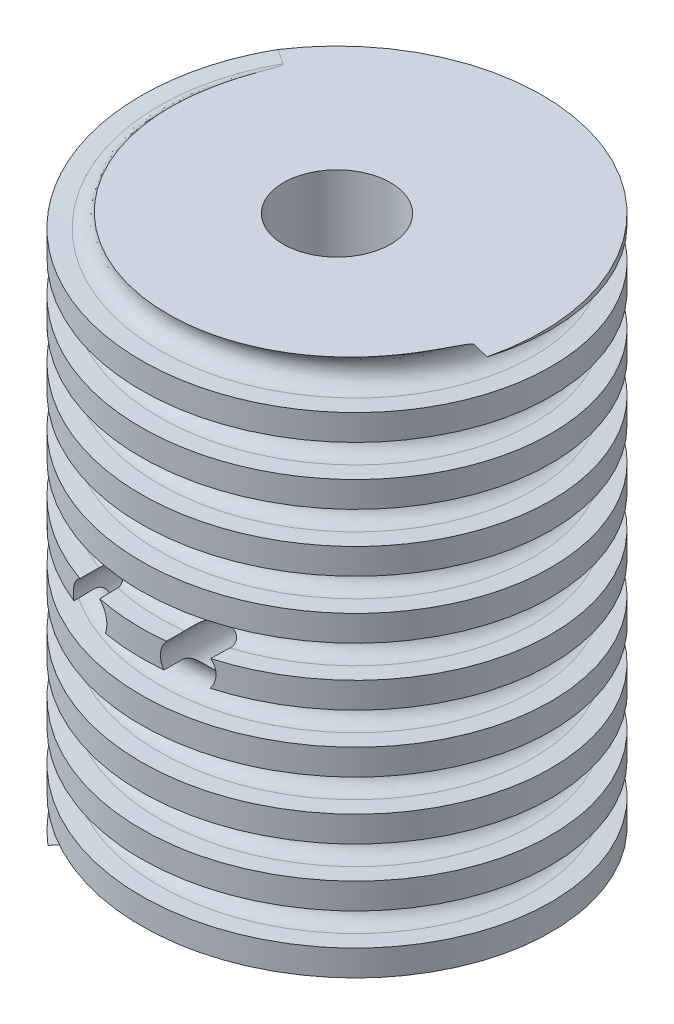
from build123d import *

# Parameters (mm, degrees)
SKETCH1_R           = 11.5
SKETCH1_R_2         = 1.5
BOSS_EXTRUDE1_DEPTH = 30
CUT_SWEEP1_PITCH    = 3.25
SKETCH7_W           = 9.56
SKETCH7_H           = 3.8
CUT_EXTRUDE1_DEPTH  = 6
SKETCH9_R           = 3
CUT_EXTRUDE5_DEPTH  = 25
CUT_EXTRUDE6_REACH  = 38.573
SKETCH8_R           = 1.25


with BuildPart() as part:
    # Sketch1 → Boss-Extrude1 (new body)
    with BuildSketch(Plane(origin=(0, 0, 0), x_dir=(1, 0, 0), z_dir=(0, 1, 0))):
        with Locations(Location((0, 0, 0), (0, 0, 270))):
            Circle(SKETCH1_R)
        with Locations(Location((0, 0, 0), (0, 0, 270))):
            Circle(SKETCH1_R_2, mode=Mode.SUBTRACT)
    extrude(amount=BOSS_EXTRUDE1_DEPTH)

    # Cut-Sweep1: the profile of Sketch3 screwed along a left-hand helix of 20 turns, 12 arcs to a turn; built about Z, then put on its axis
    cut_sweep1_z = Axis((0, 0, 0), (0, 0, 1))
    cut_sweep1_corners = [(10.5, 0, 4), (20.5, 0, 4), (20.5, 0, 2.2), (10.5, 0, 2.2), (9.6, 0, 3.1)]
    with BuildLine(mode=Mode.PRIVATE) as cut_sweep1_profile:
        Line(cut_sweep1_corners[0], cut_sweep1_corners[1])
        Line(cut_sweep1_corners[1], cut_sweep1_corners[2])
        Line(cut_sweep1_corners[2], cut_sweep1_corners[3])
        ThreePointArc((10.5, 0, 2.2), (9.863603897, 0, 2.463603897), (9.6, 0, 3.1))
        ThreePointArc((9.6, 0, 3.1), (9.863603897, 0, 3.736396103), (10.5, 0, 4))
    cut_sweep1_cap = Face(cut_sweep1_profile.wire())
    cut_sweep1_arcs = [((10.5, 0, 2.2), (9.6, 0, 2.2), (9.6, 0, 3.1), (1, 0.7071067811865482, 1)), ((9.6, 0, 3.1), (9.6, 0, 4), (10.5, 0, 4), (1, 0.7071067811865482, 1))]  # start, shoulder, end, weights
    cut_sweep1_turn_angles = [0, -15, -30, -45, -60, -75, -90, -105, -120, -135, -150, -165, -180, -195, -210, -225, -240, -255, -270, -285, -300, -315, -330, -345, -360]
    cut_sweep1_turn_weights = [1, 0.9659258262890683, 1, 0.9659258262890683, 1, 0.9659258262890683, 1, 0.9659258262890683, 1, 0.9659258262890683, 1, 0.9659258262890683, 1, 0.9659258262890683, 1, 0.9659258262890683, 1, 0.9659258262890683, 1, 0.9659258262890683, 1, 0.9659258262890683, 1, 0.9659258262890683, 1]
    cut_sweep1_turn_rails = [Edge.make_bspline([Vector(p[0], p[1], 0).rotate(cut_sweep1_z, cut_sweep1_turn_angles[k]) / cut_sweep1_turn_weights[k] + Vector(0, 0, p[2] + -CUT_SWEEP1_PITCH * cut_sweep1_turn_angles[k] / 360) for k in range(25)], [0, 0, 0, 1, 1, 2, 2, 3, 3, 4, 4, 5, 5, 6, 6, 7, 7, 8, 8, 9, 9, 10, 10, 11, 11, 12, 12, 12], 2, cut_sweep1_turn_weights) for p in cut_sweep1_corners]
    cut_sweep1_turn_sides = [*[Face.make_surface_from_curves(cut_sweep1_turn_rails[p[0]], cut_sweep1_turn_rails[p[1]]) for p in [(0, 1), (1, 2), (2, 3)]], *[Face.make_bezier_surface([[Vector(p[j][0], p[j][1], 0).rotate(cut_sweep1_z, cut_sweep1_turn_angles[2 * i + k]) / cut_sweep1_turn_weights[2 * i + k] + Vector(0, 0, p[j][2] + -CUT_SWEEP1_PITCH * cut_sweep1_turn_angles[2 * i + k] / 360) for k in range(3)] for j in range(3)], [[p[3][j] * cut_sweep1_turn_weights[2 * i + k] for k in range(3)] for j in range(3)]) for p in cut_sweep1_arcs for i in range(12)]]
    cut_sweep1 = Plane(origin=(0, -5, 0), x_dir=(-1, 0, 0), z_dir=(0, 1, 0)) * Solid(Shell([*[p.moved(Location((0, 0, CUT_SWEEP1_PITCH * i))) for i in range(20) for p in cut_sweep1_turn_sides], cut_sweep1_cap, cut_sweep1_cap.rotate(cut_sweep1_z, -7200).moved(Location((0, 0, -CUT_SWEEP1_PITCH * -7200 / 360)))]))
    add(cut_sweep1, mode=Mode.SUBTRACT)

    # Sketch7 → Cut-Extrude1 (cut)
    with BuildSketch(Plane.XY.offset(-11.5)):
        with Locations((0, 15)):
            Rectangle(SKETCH7_W, SKETCH7_H)
    extrude(amount=CUT_EXTRUDE1_DEPTH, mode=Mode.SUBTRACT)

    # Sketch9 → Cut-Extrude5 (cut)
    with BuildSketch(Plane(origin=(0, 30, 0), x_dir=(1, 0, 0), z_dir=(0, 1, 0))):
        with Locations(Location((0, 0, 0), (0, 0, 270))):
            Circle(SKETCH9_R)
    extrude(amount=-CUT_EXTRUDE5_DEPTH, mode=Mode.SUBTRACT)

    # Sketch8 → Cut-Extrude6 (cut, up to next)
    with BuildSketch(Plane(origin=(0, 0, -5.5), x_dir=(-1, 0, 0), z_dir=(0, 0, -1)), mode=Mode.PRIVATE) as cut_extrude6_sk1:
        with Locations((-2.75, 15)):
            Circle(SKETCH8_R)
    cut_extrude6_tool1 = extrude(cut_extrude6_sk1.sketch, amount=-CUT_EXTRUDE6_REACH, mode=Mode.PRIVATE) & part.part
    # Sketch8 → Cut-Extrude6 (cut, up to next)
    with BuildSketch(Plane(origin=(0, 0, -5.5), x_dir=(-1, 0, 0), z_dir=(0, 0, -1)), mode=Mode.PRIVATE) as cut_extrude6_sk2:
        with Locations((2.75, 15)):
            Circle(SKETCH8_R)
    cut_extrude6_tool2 = extrude(cut_extrude6_sk2.sketch, amount=-CUT_EXTRUDE6_REACH, mode=Mode.PRIVATE) & part.part
    add(cut_extrude6_tool1.solids().sort_by_distance((2.75, 15, -5.5))[0], mode=Mode.SUBTRACT)
    add(cut_extrude6_tool2.solids().sort_by_distance((-2.75, 15, -5.5))[0], mode=Mode.SUBTRACT)


solid = part.part
